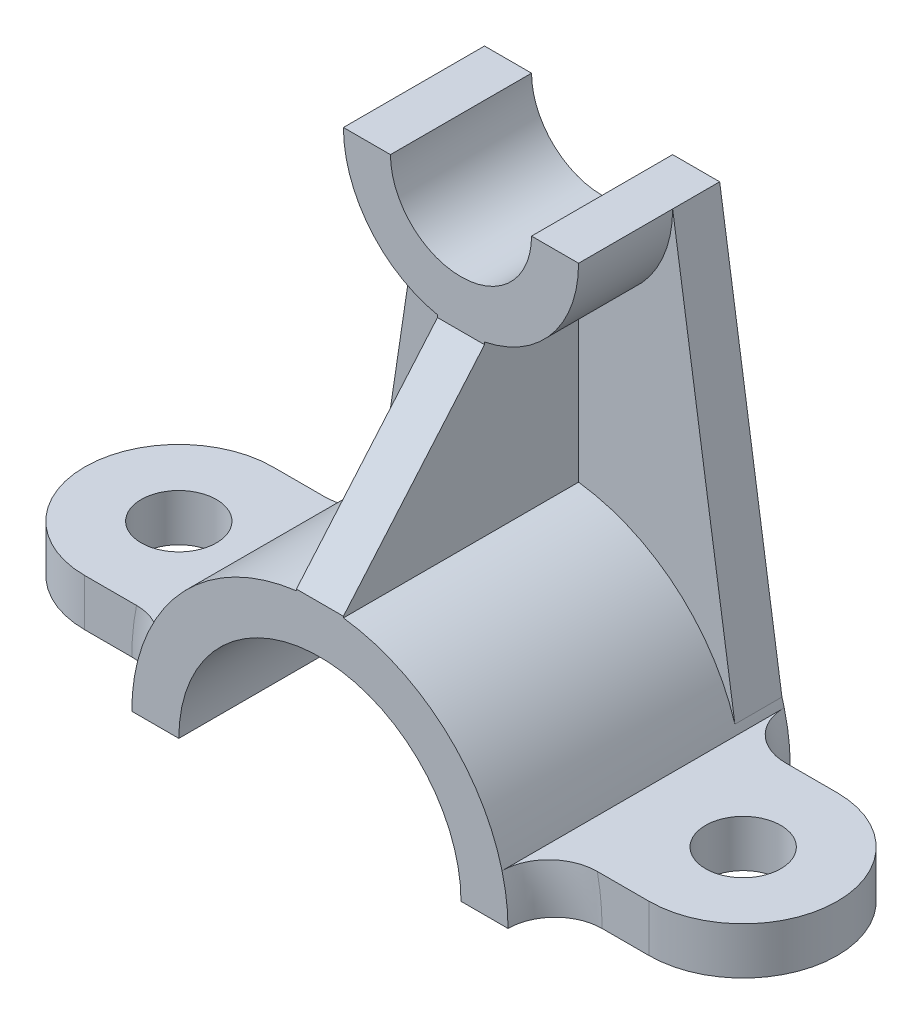
from build123d import *
from build123d.topology import SkipClean

# Parameters (mm, degrees)
BOSS_EXTRUDE1_START   = -10
BOSS_EXTRUDE1_DEPTH   = 40
SKETCH1_W             = 30
SKETCH1_H             = 10
BOSS_EXTRUDE1_2_DEPTH = 40
EXTRUDE_THIN1_DEPTH   = 60
BOSS_EXTRUDE2_DEPTH   = 30
BOSS_EXTRUDE3_START   = -10
BOSS_EXTRUDE3_DEPTH   = 10
FILLET2_R             = 10
BOSS_EXTRUDE4_DEPTH   = 5
CUT_EXTRUDE1_DEPTH    = 124.693168817
BOSS_EXTRUDE6_DEPTH   = 10


with BuildPart() as part:
    # Sketch1 → Boss-Extrude1 (new body)
    with BuildSketch(Plane.XY.offset(BOSS_EXTRUDE1_START)):
        with BuildLine():
            Line((60, 10), (38.729833462, 10))
            ThreePointArc((38.729833462, 10), (39.681187851, 5.040171699), (40, 0))
            Line((40, 0), (60, 0))
            Line((60, 0), (60, 10))
        make_face()
    extrude(amount=-BOSS_EXTRUDE1_DEPTH)



with BuildPart() as body_2:
    # Sketch1 → Boss-Extrude1 2 (new body)
    with BuildSketch(Plane.XY.offset(BOSS_EXTRUDE1_START)):
        with Locations((-45, 5)):
            Rectangle(SKETCH1_W, SKETCH1_H)
    extrude(amount=-BOSS_EXTRUDE1_2_DEPTH)


with BuildPart() as part_1:
    add(part.part)

    add(body_2.part)  # Extrude-Thin1 merges body 2
    # Sketch1<3> → Extrude-Thin1 (add)
    with BuildSketch(Plane.XY):
        with BuildLine():
            ThreePointArc((30, 0), (0, 30), (-30, 0))
            Line((-30, 0), (-40, 0))
            ThreePointArc((-40, 0), (0, 40), (40, 0))
            Line((40, 0), (30, 0))
        make_face()
    extrude(amount=-EXTRUDE_THIN1_DEPTH)



with BuildPart() as body_2_2:
    # Sketch2 → Boss-Extrude2 (new body)
    with BuildSketch(Plane(origin=(0, 0, -60), x_dir=(-1, 0, 0), z_dir=(0, 0, -1))):
        with BuildLine():
            ThreePointArc((-25, 100), (-17.67766953, 82.32233047), (0, 75))
            Line((0, 75), (0, 85))
            ThreePointArc((0, 85), (-10.606601718, 89.393398282), (-15, 100))
            Line((-15, 100), (-25, 100))
        make_face()
        with BuildLine():
            Line((0, 85), (0, 75))
            ThreePointArc((0, 75), (17.67766953, 82.32233047), (25, 100))
            Line((25, 100), (15, 100))
            ThreePointArc((15, 100), (10.606601718, 89.393398282), (0, 85))
        make_face()
    extrude(amount=-BOSS_EXTRUDE2_DEPTH)


with BuildPart() as part_2:
    add(part_1.part)

    add(body_2_2.part)  # Boss-Extrude3 merges body 2 2
    # Sketch2<5> → Boss-Extrude3 (add)
    with BuildSketch(Plane(origin=(0, 0, -60), x_dir=(-1, 0, 0), z_dir=(0, 0, -1)).offset(BOSS_EXTRUDE3_START)):
        with BuildLine():
            ThreePointArc((-38.239608802, 11.73594132), (-23.775642443, 32.167045659), (0, 40))
            Line((0, 40), (0, 75))
            ThreePointArc((0, 75), (-17.67766953, 82.32233047), (-25, 100))
            Line((-25, 100), (-38.239608802, 11.73594132))
        make_face()
        with BuildLine():
            Line((0, 75), (0, 40))
            ThreePointArc((0, 40), (23.775642443, 32.167045659), (38.239608802, 11.73594132))
            Line((38.239608802, 11.73594132), (25, 100))
            ThreePointArc((25, 100), (17.67766953, 82.32233047), (0, 75))
        make_face()
    extrude(amount=BOSS_EXTRUDE3_DEPTH)

    # Fillet2
    fillet2_edges = [part_2.edges().sort_by_distance(p)[0] for p in [
        (39.681187851, 5.040171699, -50),
        (-39.681187851, 5.040171699, -50),
        (-39.681187851, 5.040171699, -10),
        (39.681187851, 5.040171699, -10),
    ]]
    fillet(fillet2_edges, radius=FILLET2_R - 0.0001)  # a hair under: the kernel refuses the full size

    # Sketch3 → Boss-Extrude4 (add, symmetric)
    with BuildSketch(Plane(origin=(0, 0, 0), x_dir=(0, 0, -1), z_dir=(1, 0, 0))):
        Polygon((30, 75), (0, 40), (0, 37.743013402), (50.362835489, 37.743013402), (50.362835489, 76.354795309), (30, 76.354795309), align=None)
    extrude(amount=BOSS_EXTRUDE4_DEPTH, both=True)

    # Sketch4 → Cut-Extrude1 (cut, through all)
    with BuildSketch(Plane(origin=(0, 10, 0), x_dir=(1, 0, 0), z_dir=(0, 1, 0))):
        with BuildLine():
            Line((60, 22), (60, 38))
            ThreePointArc((60, 38), (52, 30), (60, 22))
        make_face()
        with BuildLine():
            ThreePointArc((68, 30), (65.656854249, 35.656854249), (60, 38))
            Line((60, 38), (60, 22))
            ThreePointArc((60, 22), (65.656854249, 24.343145751), (68, 30))
        make_face()
    cut_extrude1 = extrude(amount=-CUT_EXTRUDE1_DEPTH, mode=Mode.SUBTRACT)

    # Sketch4<7> → Boss-Extrude6 (add)
    with SkipClean():  # the faces are left unmerged after this step: merging them gives an invalid solid
        with BuildSketch(Plane(origin=(0, 10, 0), x_dir=(1, 0, 0), z_dir=(0, 1, 0))):
            with BuildLine():
                ThreePointArc((60, 10), (80, 30), (60, 50))
                Line((60, 50), (60, 38))
                ThreePointArc((60, 38), (65.656854249, 35.656854249), (68, 30))
                ThreePointArc((68, 30), (65.656854249, 24.343145751), (60, 22))
                Line((60, 22), (60, 10))
            make_face()
        boss_extrude6 = extrude(amount=-BOSS_EXTRUDE6_DEPTH)

    # Mirror1: Cut-Extrude1, Boss-Extrude6 across plane
    with SkipClean():  # the faces are left unmerged after this step: merging them gives an invalid solid
        add(cut_extrude1.mirror(Plane(origin=(0, 0, 0), x_dir=(0, 0, 1), z_dir=(1, 0, 0))), mode=Mode.SUBTRACT)
        add(boss_extrude6.mirror(Plane(origin=(0, 0, 0), x_dir=(0, 0, 1), z_dir=(1, 0, 0))))


solid = part_2.part
